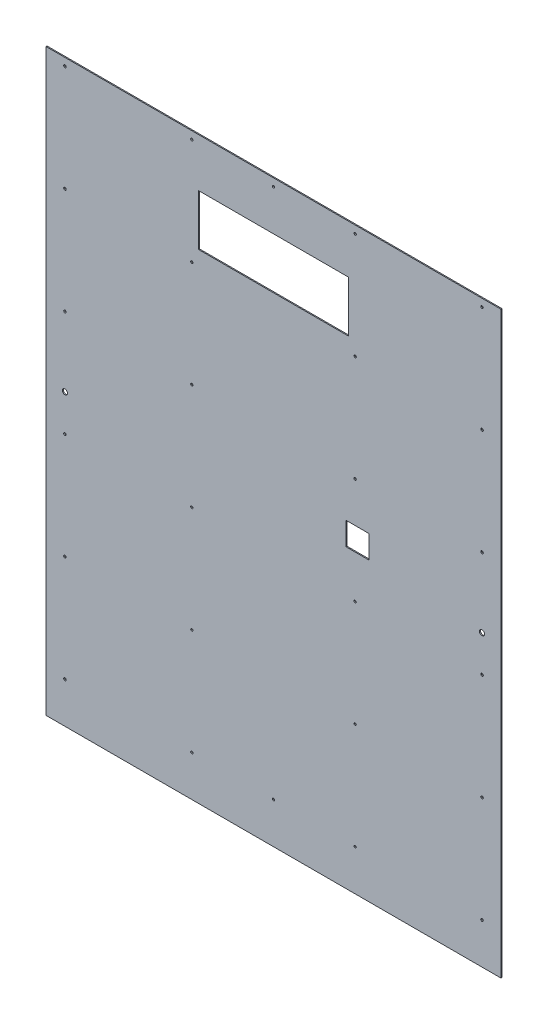
from build123d import *

# Parameters (mm, degrees)
SKETCH_1_W             = 891
SKETCH_1_H             = 1135
SKETCH_1_R             = 2.25
SM_BASE_FLANGE_1_DEPTH = 2
CUT_EXTRUDE_1_REACH    = 1444.952
SKETCH_7_W             = 294.359434409
SKETCH_7_H             = 100
CUT_EXTRUDE_2_REACH    = 1444.952
SKETCH_8_R             = 5
CUT_EXTRUDE_3_REACH    = 1444.952
SKETCH_9_W             = 45
SKETCH_9_H             = 45
CUT_EXTRUDE_4_REACH    = 1444.952
SKETCH_10_R            = 2.5


# Sheet-metal steps are written as plain solids
with BuildPart() as part:
    # Sketch 1 → Базовая кромка1 (new body)
    with BuildSketch(Plane.XY):
        with Locations((445.5, 567.5)):
            Rectangle(SKETCH_1_W, SKETCH_1_H)
        with Locations((285.5, 912)):
            Circle(SKETCH_1_R, mode=Mode.SUBTRACT)
        with Locations((285.5, 704)):
            Circle(SKETCH_1_R, mode=Mode.SUBTRACT)
        with Locations((285.5, 496)):
            Circle(SKETCH_1_R, mode=Mode.SUBTRACT)
        with Locations((285.5, 288)):
            Circle(SKETCH_1_R, mode=Mode.SUBTRACT)
        with Locations((285.5, 80)):
            Circle(SKETCH_1_R, mode=Mode.SUBTRACT)
        with Locations((445.5, 80)):
            Circle(SKETCH_1_R, mode=Mode.SUBTRACT)
        with Locations((605.5, 80)):
            Circle(SKETCH_1_R, mode=Mode.SUBTRACT)
        with Locations((605.5, 288)):
            Circle(SKETCH_1_R, mode=Mode.SUBTRACT)
        with Locations((605.5, 496)):
            Circle(SKETCH_1_R, mode=Mode.SUBTRACT)
        with Locations((605.5, 704)):
            Circle(SKETCH_1_R, mode=Mode.SUBTRACT)
        with Locations((605.5, 912)):
            Circle(SKETCH_1_R, mode=Mode.SUBTRACT)
        with Locations((605.5, 1120)):
            Circle(SKETCH_1_R, mode=Mode.SUBTRACT)
        with Locations((445.5, 1120)):
            Circle(SKETCH_1_R, mode=Mode.SUBTRACT)
        with Locations((285.5, 1120)):
            Circle(SKETCH_1_R, mode=Mode.SUBTRACT)
    extrude(amount=-SM_BASE_FLANGE_1_DEPTH)

    # Эскиз7 → Вырез-Вытянуть1 (cut, up to next)
    with BuildSketch(Plane(origin=(0, 0, -2), x_dir=(-1, 0, 0), z_dir=(0, 0, -1)), mode=Mode.PRIVATE) as cut_extrude_1_sk1:
        with Locations((-445.494464103, 990)):
            Rectangle(SKETCH_7_W, SKETCH_7_H)
    cut_extrude_1_tool1 = extrude(cut_extrude_1_sk1.sketch, amount=-CUT_EXTRUDE_1_REACH, mode=Mode.PRIVATE) & part.part
    add(cut_extrude_1_tool1.solids().sort_by_distance((445.494464, 990, -2))[0], mode=Mode.SUBTRACT)

    # Эскиз8 → Вырез-Вытянуть2 (cut, up to next)
    with BuildSketch(Plane(origin=(0, 0, -2), x_dir=(-1, 0, 0), z_dir=(0, 0, -1)), mode=Mode.PRIVATE) as cut_extrude_2_sk1:
        with Locations((-36.893974432, 567.5)):
            Circle(SKETCH_8_R)
    cut_extrude_2_tool1 = extrude(cut_extrude_2_sk1.sketch, amount=-CUT_EXTRUDE_2_REACH, mode=Mode.PRIVATE) & part.part
    # Эскиз8 → Вырез-Вытянуть2 (cut, up to next)
    with BuildSketch(Plane(origin=(0, 0, -2), x_dir=(-1, 0, 0), z_dir=(0, 0, -1)), mode=Mode.PRIVATE) as cut_extrude_2_sk2:
        with Locations((-854.014883074, 567.5)):
            Circle(SKETCH_8_R)
    cut_extrude_2_tool2 = extrude(cut_extrude_2_sk2.sketch, amount=-CUT_EXTRUDE_2_REACH, mode=Mode.PRIVATE) & part.part
    add(cut_extrude_2_tool1.solids().sort_by_distance((36.893974, 567.5, -2))[0], mode=Mode.SUBTRACT)
    add(cut_extrude_2_tool2.solids().sort_by_distance((854.014883, 567.5, -2))[0], mode=Mode.SUBTRACT)

    # Эскиз9 → Вырез-Вытянуть3 (cut, up to next)
    with BuildSketch(Plane.XY, mode=Mode.PRIVATE) as cut_extrude_3_sk1:
        with Locations((609.814746898, 602.5)):
            Rectangle(SKETCH_9_W, SKETCH_9_H)
    cut_extrude_3_tool1 = extrude(cut_extrude_3_sk1.sketch, amount=-CUT_EXTRUDE_3_REACH, mode=Mode.PRIVATE) & part.part
    add(cut_extrude_3_tool1.solids().sort_by_distance((609.814747, 602.5, 0))[0], mode=Mode.SUBTRACT)

    # Эскиз10 → Вырез-Вытянуть4 (cut, up to next)
    with BuildSketch(Plane(origin=(0, 0, -2), x_dir=(-1, 0, 0), z_dir=(0, 0, -1)), mode=Mode.PRIVATE) as cut_extrude_4_sk1:
        with Locations((-854.094953773, 1120)):
            Circle(SKETCH_10_R)
    cut_extrude_4_tool1 = extrude(cut_extrude_4_sk1.sketch, amount=-CUT_EXTRUDE_4_REACH, mode=Mode.PRIVATE) & part.part
    # Эскиз10 → Вырез-Вытянуть4 (cut, up to next)
    with BuildSketch(Plane(origin=(0, 0, -2), x_dir=(-1, 0, 0), z_dir=(0, 0, -1)), mode=Mode.PRIVATE) as cut_extrude_4_sk2:
        with Locations((-854.094953773, 912)):
            Circle(SKETCH_10_R)
    cut_extrude_4_tool2 = extrude(cut_extrude_4_sk2.sketch, amount=-CUT_EXTRUDE_4_REACH, mode=Mode.PRIVATE) & part.part
    # Эскиз10 → Вырез-Вытянуть4 (cut, up to next)
    with BuildSketch(Plane(origin=(0, 0, -2), x_dir=(-1, 0, 0), z_dir=(0, 0, -1)), mode=Mode.PRIVATE) as cut_extrude_4_sk3:
        with Locations((-854.094953773, 704)):
            Circle(SKETCH_10_R)
    cut_extrude_4_tool3 = extrude(cut_extrude_4_sk3.sketch, amount=-CUT_EXTRUDE_4_REACH, mode=Mode.PRIVATE) & part.part
    # Эскиз10 → Вырез-Вытянуть4 (cut, up to next)
    with BuildSketch(Plane(origin=(0, 0, -2), x_dir=(-1, 0, 0), z_dir=(0, 0, -1)), mode=Mode.PRIVATE) as cut_extrude_4_sk4:
        with Locations((-854.094953773, 496)):
            Circle(SKETCH_10_R)
    cut_extrude_4_tool4 = extrude(cut_extrude_4_sk4.sketch, amount=-CUT_EXTRUDE_4_REACH, mode=Mode.PRIVATE) & part.part
    # Эскиз10 → Вырез-Вытянуть4 (cut, up to next)
    with BuildSketch(Plane(origin=(0, 0, -2), x_dir=(-1, 0, 0), z_dir=(0, 0, -1)), mode=Mode.PRIVATE) as cut_extrude_4_sk5:
        with Locations((-854.094953773, 288)):
            Circle(SKETCH_10_R)
    cut_extrude_4_tool5 = extrude(cut_extrude_4_sk5.sketch, amount=-CUT_EXTRUDE_4_REACH, mode=Mode.PRIVATE) & part.part
    # Эскиз10 → Вырез-Вытянуть4 (cut, up to next)
    with BuildSketch(Plane(origin=(0, 0, -2), x_dir=(-1, 0, 0), z_dir=(0, 0, -1)), mode=Mode.PRIVATE) as cut_extrude_4_sk6:
        with Locations((-854.094953773, 80)):
            Circle(SKETCH_10_R)
    cut_extrude_4_tool6 = extrude(cut_extrude_4_sk6.sketch, amount=-CUT_EXTRUDE_4_REACH, mode=Mode.PRIVATE) & part.part
    # Эскиз10 → Вырез-Вытянуть4 (cut, up to next)
    with BuildSketch(Plane(origin=(0, 0, -2), x_dir=(-1, 0, 0), z_dir=(0, 0, -1)), mode=Mode.PRIVATE) as cut_extrude_4_sk7:
        with Locations((-36.893974432, 1120)):
            Circle(SKETCH_10_R)
    cut_extrude_4_tool7 = extrude(cut_extrude_4_sk7.sketch, amount=-CUT_EXTRUDE_4_REACH, mode=Mode.PRIVATE) & part.part
    # Эскиз10 → Вырез-Вытянуть4 (cut, up to next)
    with BuildSketch(Plane(origin=(0, 0, -2), x_dir=(-1, 0, 0), z_dir=(0, 0, -1)), mode=Mode.PRIVATE) as cut_extrude_4_sk8:
        with Locations((-36.893974432, 912)):
            Circle(SKETCH_10_R)
    cut_extrude_4_tool8 = extrude(cut_extrude_4_sk8.sketch, amount=-CUT_EXTRUDE_4_REACH, mode=Mode.PRIVATE) & part.part
    # Эскиз10 → Вырез-Вытянуть4 (cut, up to next)
    with BuildSketch(Plane(origin=(0, 0, -2), x_dir=(-1, 0, 0), z_dir=(0, 0, -1)), mode=Mode.PRIVATE) as cut_extrude_4_sk9:
        with Locations((-36.893974432, 704)):
            Circle(SKETCH_10_R)
    cut_extrude_4_tool9 = extrude(cut_extrude_4_sk9.sketch, amount=-CUT_EXTRUDE_4_REACH, mode=Mode.PRIVATE) & part.part
    # Эскиз10 → Вырез-Вытянуть4 (cut, up to next)
    with BuildSketch(Plane(origin=(0, 0, -2), x_dir=(-1, 0, 0), z_dir=(0, 0, -1)), mode=Mode.PRIVATE) as cut_extrude_4_sk10:
        with Locations((-36.893974432, 496)):
            Circle(SKETCH_10_R)
    cut_extrude_4_tool10 = extrude(cut_extrude_4_sk10.sketch, amount=-CUT_EXTRUDE_4_REACH, mode=Mode.PRIVATE) & part.part
    # Эскиз10 → Вырез-Вытянуть4 (cut, up to next)
    with BuildSketch(Plane(origin=(0, 0, -2), x_dir=(-1, 0, 0), z_dir=(0, 0, -1)), mode=Mode.PRIVATE) as cut_extrude_4_sk11:
        with Locations((-36.893974432, 288)):
            Circle(SKETCH_10_R)
    cut_extrude_4_tool11 = extrude(cut_extrude_4_sk11.sketch, amount=-CUT_EXTRUDE_4_REACH, mode=Mode.PRIVATE) & part.part
    # Эскиз10 → Вырез-Вытянуть4 (cut, up to next)
    with BuildSketch(Plane(origin=(0, 0, -2), x_dir=(-1, 0, 0), z_dir=(0, 0, -1)), mode=Mode.PRIVATE) as cut_extrude_4_sk12:
        with Locations((-36.893974432, 80)):
            Circle(SKETCH_10_R)
    cut_extrude_4_tool12 = extrude(cut_extrude_4_sk12.sketch, amount=-CUT_EXTRUDE_4_REACH, mode=Mode.PRIVATE) & part.part
    add(cut_extrude_4_tool1.solids().sort_by_distance((854.094954, 1120, -2))[0], mode=Mode.SUBTRACT)
    add(cut_extrude_4_tool2.solids().sort_by_distance((854.094954, 912, -2))[0], mode=Mode.SUBTRACT)
    add(cut_extrude_4_tool3.solids().sort_by_distance((854.094954, 704, -2))[0], mode=Mode.SUBTRACT)
    add(cut_extrude_4_tool4.solids().sort_by_distance((854.094954, 496, -2))[0], mode=Mode.SUBTRACT)
    add(cut_extrude_4_tool5.solids().sort_by_distance((854.094954, 288, -2))[0], mode=Mode.SUBTRACT)
    add(cut_extrude_4_tool6.solids().sort_by_distance((854.094954, 80, -2))[0], mode=Mode.SUBTRACT)
    add(cut_extrude_4_tool7.solids().sort_by_distance((36.893974, 1120, -2))[0], mode=Mode.SUBTRACT)
    add(cut_extrude_4_tool8.solids().sort_by_distance((36.893974, 912, -2))[0], mode=Mode.SUBTRACT)
    add(cut_extrude_4_tool9.solids().sort_by_distance((36.893974, 704, -2))[0], mode=Mode.SUBTRACT)
    add(cut_extrude_4_tool10.solids().sort_by_distance((36.893974, 496, -2))[0], mode=Mode.SUBTRACT)
    add(cut_extrude_4_tool11.solids().sort_by_distance((36.893974, 288, -2))[0], mode=Mode.SUBTRACT)
    add(cut_extrude_4_tool12.solids().sort_by_distance((36.893974, 80, -2))[0], mode=Mode.SUBTRACT)


solid = part.part
